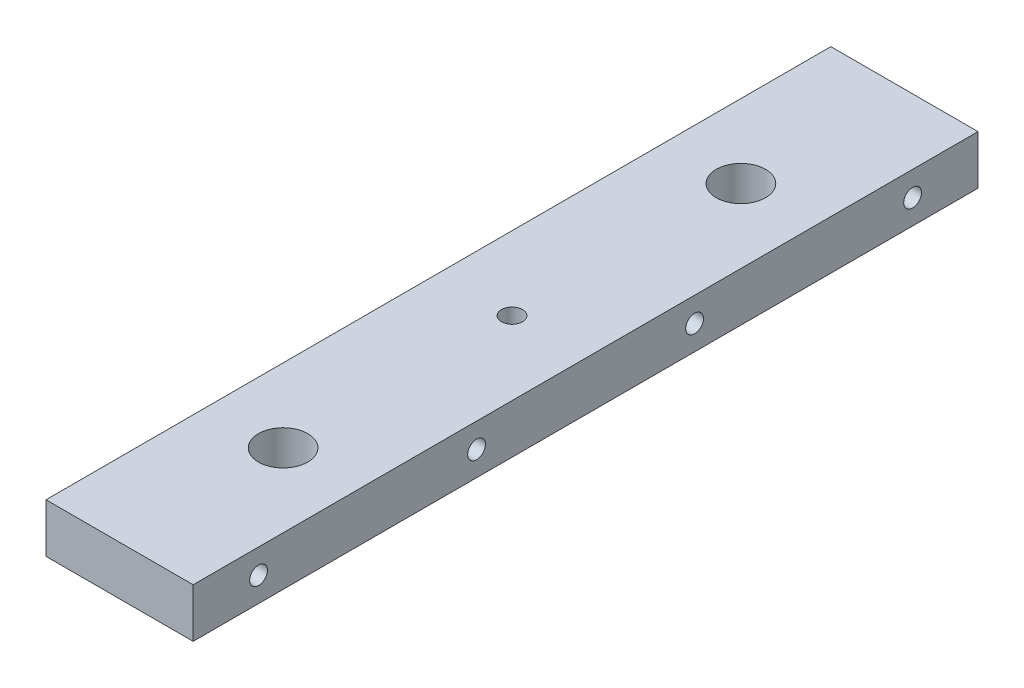
from build123d import *

# Parameters (mm, degrees)
SKETCH2_W                 = 28.575
SKETCH2_H                 = 152.4
BOSS_EXTRUDE1_DEPTH       = 9.525
LPATTERN1_COUNT           = 4
LPATTERN1_PITCH           = 42.333333333
LPATTERN2_COUNT           = 4
LPATTERN2_PITCH           = 42.333333333
SKETCH12_R                = 2.05
SKETCH12_R_2              = 4.7879
CUT_EXTRUDE1_DEPTH        = 156.348048749
F_5_CLEARANCE_HOLE5_D     = 3.4544
F_5_CLEARANCE_HOLE5_DEPTH = 12.7
F_5_CLEARANCE_HOLE5_TIP   = 1.037806461


with BuildPart() as part:
    # Sketch2 → Boss-Extrude1 (new body)
    with BuildSketch(Plane(origin=(0, 0, 0), x_dir=(1, 0, 0), z_dir=(0, 1, 0))):
        with Locations((14.2875, 76.2)):
            Rectangle(SKETCH2_W, SKETCH2_H)
    extrude(amount=BOSS_EXTRUDE1_DEPTH)

    # Sketch9 → #5 Clearance Hole3 (revolve, cut)
    with BuildSketch(Plane(origin=(0, 4.7625, -139.7), x_dir=(0, 0, 1), z_dir=(0, 1, 0))):
        Polygon((0, 0), (0, 13.737806461), (1.7272, 12.7), (1.7272, 0), align=None)
    f_5_clearance_hole3 = revolve(axis=Axis((-6.35, 4.7625, -139.7), (1, 0, 0)), mode=Mode.SUBTRACT)

    # LPattern1: #5 Clearance Hole3 ×4, 1 skipped
    with Locations(*[(0, 0, i * LPATTERN1_PITCH) for i in range(1, LPATTERN1_COUNT) if i not in (2,)]):
        add(f_5_clearance_hole3, mode=Mode.SUBTRACT)

    # Sketch11 → #5 Clearance Hole4 (revolve, cut)
    with BuildSketch(Plane(origin=(28.575, 4.7625, -12.7), x_dir=(0, 0, -1), z_dir=(0, 1, 0))):
        Polygon((0, 0), (0, 13.737806461), (1.7272, 12.7), (1.7272, 0), align=None)
    f_5_clearance_hole4 = revolve(axis=Axis((34.925, 4.7625, -12.7), (-1, 0, 0)), mode=Mode.SUBTRACT)

    # LPattern2: #5 Clearance Hole4 ×4
    with Locations(*[(0, 0, -i * LPATTERN2_PITCH) for i in range(1, LPATTERN2_COUNT)]):
        add(f_5_clearance_hole4, mode=Mode.SUBTRACT)

    # Sketch12 → Cut-Extrude1 (cut, through all)
    with BuildSketch(Plane(origin=(0, 9.525, 0), x_dir=(1, 0, 0), z_dir=(0, 1, 0))):
        with Locations((14.2875, 76.2)):
            Circle(SKETCH12_R)
        with Locations((14.2875, 31.75)):
            Circle(SKETCH12_R_2)
        with Locations((14.2875, 120.65)):
            Circle(SKETCH12_R_2)
    extrude(amount=-CUT_EXTRUDE1_DEPTH, mode=Mode.SUBTRACT)

    # #5 Clearance Hole5
    with Locations(Plane.ZY):
        with Locations((-38.1, 4.7625), (-69.85, 4.7625)):
            Hole(F_5_CLEARANCE_HOLE5_D / 2, depth=F_5_CLEARANCE_HOLE5_DEPTH)
            with Locations((0, 0, -(F_5_CLEARANCE_HOLE5_DEPTH + F_5_CLEARANCE_HOLE5_TIP / 2))):  # 118° drill point
                Cone(0, F_5_CLEARANCE_HOLE5_D / 2, F_5_CLEARANCE_HOLE5_TIP, mode=Mode.SUBTRACT)


solid = part.part
